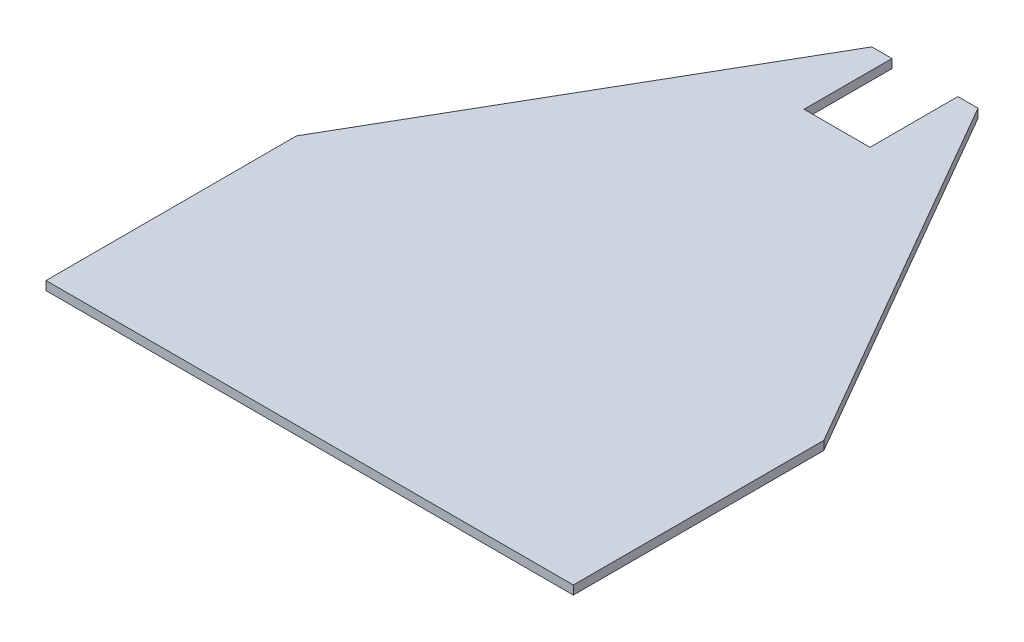
from build123d import *

# Parameters (mm, degrees)
BOSS_EXTRUDE2_DEPTH = 20


with BuildPart() as part:
    # Sketch1 → Boss-Extrude2 (new body)
    with BuildSketch(Plane(origin=(0, 0, 0), x_dir=(1, 0, 0), z_dir=(0, 1, 0))):
        Polygon((600, 0), (-600, 0), (-600, 570), (-120.799276573, 1400), (-75, 1400), (-75, 1200), (75, 1200), (75, 1400), (120.799276573, 1400), (600, 570), align=None)
    extrude(amount=BOSS_EXTRUDE2_DEPTH)


solid = part.part
